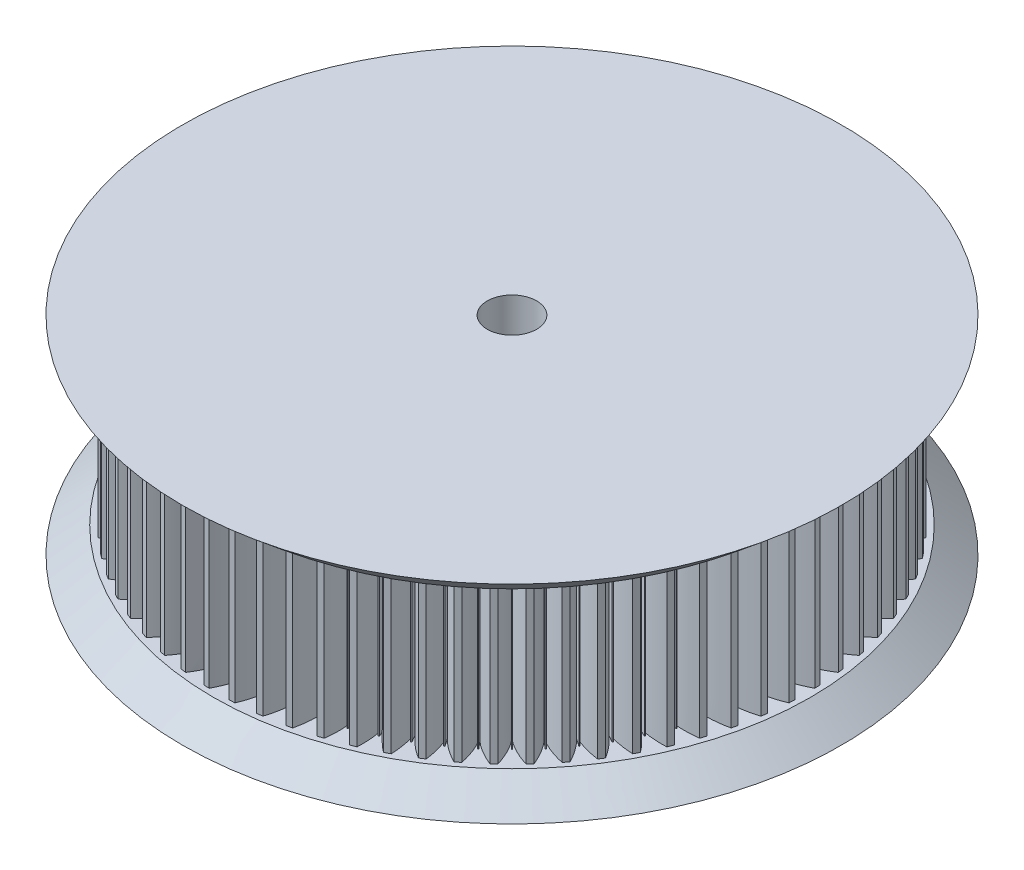
from build123d import *

# Parameters (mm, degrees)
SKETCH2_R               = 22.57
BOSS_EXTRUDE1_DEPTH     = 12
CUT_EXTRUDE1_DEPTH      = 35.099997067
CIRPATTERN1_COUNT       = 72
SKETCH5_R               = 5.3375
BOSS_EXTRUDE3_DEPTH     = 12
SKETCH16_R              = 23
BOSS_EXTRUDE4_DEPTH     = 2
BOSS_EXTRUDE4_DRAFT     = -50
MIRROR1_COPY_1_SKETCH_R = 23
MIRROR1_COPY_1_DEPTH    = 2
MIRROR1_COPY_1_DRAFT    = -50
SKETCH17_R              = 1.9
CUT_EXTRUDE7_DEPTH      = 16
SKETCH18_R              = 4.5
CUT_EXTRUDE8_DEPTH      = 2.75


with BuildPart() as part:
    # Sketch2 → Boss-Extrude1 (new body)
    with BuildSketch(Plane(origin=(0, 0, 0), x_dir=(1, 0, 0), z_dir=(0, 1, 0))):
        with Locations(Location((0, 0, 0), (0, 0, 270))):
            Circle(SKETCH2_R)
    extrude(amount=BOSS_EXTRUDE1_DEPTH)

    # Sketch3 → Cut-Extrude1 (cut, through all)
    with BuildSketch(Plane(origin=(0, 0, 0), x_dir=(1, 0, 0), z_dir=(0, 1, 0))):
        with BuildLine():
            add(Edge.make_bspline(
                [(-0.035898055, 20.360925801), (-0.038546171, 20.444644882), (-0.062384461, 20.631843284), (-0.130341895, 20.959951933), (-0.253005053, 21.382478516), (-0.451907977, 21.911935061), (-0.744679076, 22.538199815), (-1.147257143, 23.249122011), (-1.89702548, 24.360629748), (-2.601666137, 25.167629099), (-3.135017589, 25.699552534)],
                knots=[0, 0, 0, 0, 0.040001069, 0.090001149, 0.160001144, 0.250001075, 0.360000951, 0.49000078, 0.640000563, 1, 1, 1, 1], degree=3))
            ThreePointArc((-3.135017589, 25.699552534), (0, 25.89006249), (3.135017589, 25.699552534))
            add(Edge.make_bspline(
                [(0.035898055, 20.360925801), (0.038546171, 20.444644882), (0.062384461, 20.631843284), (0.130341895, 20.959951933), (0.253005053, 21.382478516), (0.451907977, 21.911935061), (0.744679076, 22.538199815), (1.147257143, 23.249122011), (1.89702548, 24.360629748), (2.601666137, 25.167629099), (3.135017589, 25.699552534)],
                knots=[0, 0, 0, 0, 0.040001069, 0.090001149, 0.160001144, 0.250001075, 0.360000951, 0.49000078, 0.640000563, 1, 1, 1, 1], degree=3))
            Line((0.035898055, 20.360925801), (0.037372949, 21.197467054))
            ThreePointArc((0.037372949, 21.197467054), (0, 21.1975), (-0.037372949, 21.197467054))
            Line((-0.037372949, 21.197467054), (-0.035898055, 20.360925801))
        make_face()
    cut_extrude1 = extrude(amount=CUT_EXTRUDE1_DEPTH, mode=Mode.SUBTRACT)

    # CirPattern1: Cut-Extrude1 ×72 about axis
    cirpattern1_axis = Axis((0, -0.6, 0), (0, 1, 0))
    for i in range(1, CIRPATTERN1_COUNT):
        add(cut_extrude1.rotate(cirpattern1_axis, i * 360 / CIRPATTERN1_COUNT), mode=Mode.SUBTRACT)

    # Sketch5 → Boss-Extrude3 (add)
    with BuildSketch(Plane(origin=(0, 0, 0), x_dir=(1, 0, 0), z_dir=(0, 1, 0))):
        Circle(SKETCH5_R)
    extrude(amount=BOSS_EXTRUDE3_DEPTH)


with BuildPart() as boss_extrude4_tool:
    # Sketch16 → Boss-Extrude4 (with draft: the straight prism first)
    with BuildSketch(Plane(origin=(0, 12, 0), x_dir=(1, 0, 0), z_dir=(0, 1, 0))):
        Circle(SKETCH16_R)
    extrude(amount=BOSS_EXTRUDE4_DEPTH)
    # Boss-Extrude4: the draft: its side faces are tilted about the plane it starts from
    boss_extrude4_sides = [boss_extrude4_tool.faces().sort_by_distance(p)[0] for p in [
        (-23, 13, 0),
    ]]
    draft(boss_extrude4_sides, Plane(origin=(0, 12, 0), x_dir=(1, 0, 0), z_dir=(0, 1, 0)), BOSS_EXTRUDE4_DRAFT)


with BuildPart() as part_1:
    add(part.part)

    # Boss-Extrude4: add boss_extrude4_tool
    add(boss_extrude4_tool.part)


with BuildPart() as mirror1_copy_1_tool:
    # Mirror1 copy 1 sketch → Mirror1 copy 1 (with draft: the straight prism first)
    with BuildSketch(Plane.XZ):
        Circle(MIRROR1_COPY_1_SKETCH_R)
    extrude(amount=MIRROR1_COPY_1_DEPTH)
    # Mirror1 copy 1: the draft: its side faces are tilted about the plane it starts from
    mirror1_copy_1_sides = [mirror1_copy_1_tool.faces().sort_by_distance(p)[0] for p in [
        (-23, -1, 0),
    ]]
    draft(mirror1_copy_1_sides, Plane.XZ, MIRROR1_COPY_1_DRAFT)


with BuildPart() as part_2:
    add(part_1.part)

    # Mirror1 copy 1: add mirror1_copy_1_tool
    add(mirror1_copy_1_tool.part)

    # Sketch17 → Cut-Extrude7 (cut)
    with BuildSketch(Plane.XZ.offset(2)):
        with Locations(Location((0, 0, 0), (0, 0, 270))):
            Circle(SKETCH17_R)
    extrude(amount=-CUT_EXTRUDE7_DEPTH, mode=Mode.SUBTRACT)

    # Sketch18 → Cut-Extrude8 (cut)
    with BuildSketch(Plane.XZ.offset(2)):
        with Locations(Location((0, 0, 0), (0, 0, 270))):
            Circle(SKETCH18_R)
    extrude(amount=-CUT_EXTRUDE8_DEPTH, mode=Mode.SUBTRACT)


solid = part_2.part
